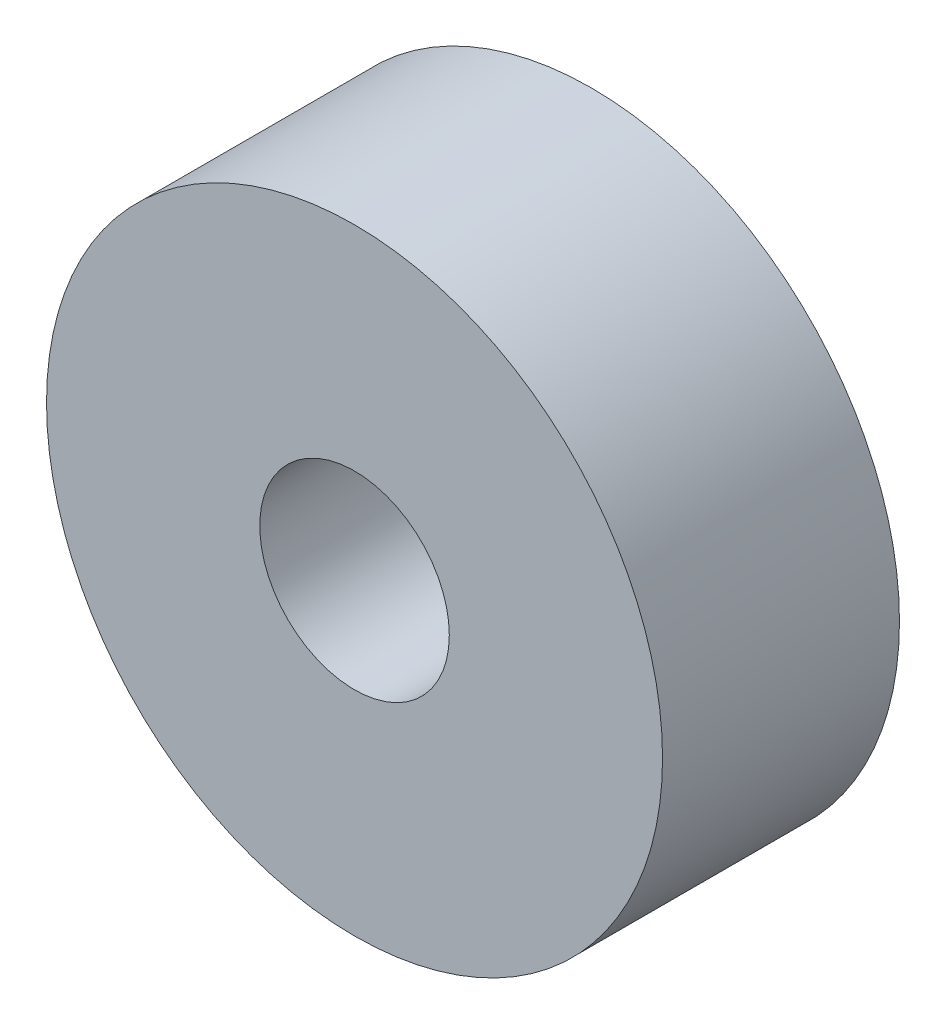
from build123d import *

# Parameters (mm, degrees)
SKETCH_1_R      = 6.5
SKETCH_1_R_2    = 2
EXTRUDE_1_DEPTH = 5


with BuildPart() as part:
    # Эскиз1 → Бобышка-Вытянуть1 (new body)
    with BuildSketch(Plane.XY):
        Circle(SKETCH_1_R)
        Circle(SKETCH_1_R_2, mode=Mode.SUBTRACT)
    extrude(amount=EXTRUDE_1_DEPTH)


solid = part.part
